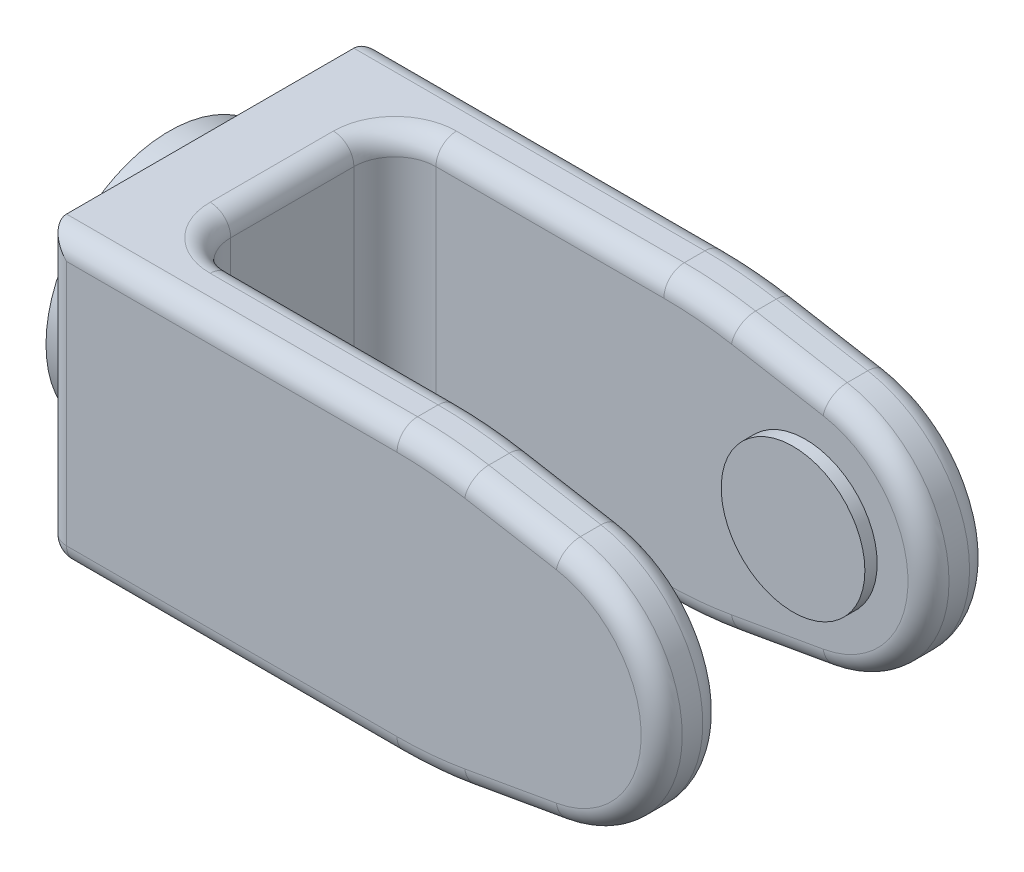
from build123d import *

# Parameters (mm, degrees)
BOSS_EXTRUDE1_DEPTH = 40
SKETCH2_W           = 180
SKETCH2_H           = 50
CUT_EXTRUDE1_DEPTH  = 171.293863659
SKETCH3_R           = 17.5
BOSS_EXTRUDE3_DEPTH = 3
SKETCH4_R           = 30
BOSS_EXTRUDE4_DEPTH = 10
SKETCH5_R           = 25
BOSS_EXTRUDE5_DEPTH = 3
FILLET2_R           = 100
FILLET3_R           = 10
FILLET4_R           = 5


with BuildPart() as part:
    # Sketch1 → Boss-Extrude1 (new, symmetric)
    with BuildSketch(Plane.XY):
        with BuildLine():
            Line((0, 0), (94.268250808, 0))
            Line((94.268250808, 0), (125.20944533, 5.45576741))
            ThreePointArc((125.20944533, 5.45576741), (150, 35), (125.20944533, 64.54423259))
            Line((125.20944533, 64.54423259), (94.268250808, 70))
            Line((94.268250808, 70), (0, 70))
            Line((0, 70), (0, 0))
        make_face()
    extrude(amount=BOSS_EXTRUDE1_DEPTH, both=True)

    # Sketch2 → Cut-Extrude1 (cut, through all)
    with BuildSketch(Plane(origin=(0, 0, 0), x_dir=(1, 0, 0), z_dir=(0, 1, 0))):
        with Locations((110, 0)):
            Rectangle(SKETCH2_W, SKETCH2_H)
    extrude(amount=CUT_EXTRUDE1_DEPTH, mode=Mode.SUBTRACT)

    # Sketch3 → Boss-Extrude3 (add)
    with BuildSketch(Plane.XY.offset(-25)):
        with Locations((120, 35)):
            Circle(SKETCH3_R)
    boss_extrude3 = extrude(amount=BOSS_EXTRUDE3_DEPTH)

    # Mirror1: Boss-Extrude3 across plane
    add(boss_extrude3.mirror(Plane.XY))

    # Sketch4 → Boss-Extrude4 (add)
    with BuildSketch(Plane.ZY):
        with Locations((0, 35)):
            Circle(SKETCH4_R)
    extrude(amount=BOSS_EXTRUDE4_DEPTH)

    # Sketch5 → Boss-Extrude5 (add)
    with BuildSketch(Plane.ZY.offset(10)):
        with Locations((0, 35)):
            Circle(SKETCH5_R)
    extrude(amount=BOSS_EXTRUDE5_DEPTH)

    # Fillet2
    fillet2_edges = [part.edges().sort_by_distance(p)[0] for p in [
        (94.268250808, 70, 32.5),
        (94.268250808, 0, 32.5),
        (94.268250808, 70, -32.5),
        (94.268250808, 0, -32.5),
    ]]
    fillet(fillet2_edges, radius=FILLET2_R)

    # Fillet3
    fillet3_edges = [part.edges().sort_by_distance(p)[0] for p in [
        (20, 35, 25),
        (20, 35, -25),
    ]]
    fillet(fillet3_edges, radius=FILLET3_R)

    # Fillet4
    fillet4_edges = [part.edges().sort_by_distance(p)[0] for p in [
        (0, 0, 0),
        (150, 35, 40),
        (114.046823776, 66.512503946, 40),
        (150, 35, 25),
        (114.046823776, 3.487496054, 25),
        (150, 35, -25),
        (114.046823776, 66.512503946, -25),
        (0, 35, 40),
        (57.759692228, 70, -25),
        (42.759692228, 70, -40),
        (42.759692228, 70, 40),
        (114.046823776, 3.487496054, -40),
        (94.23495873, 0.380530191, -40),
        (94.23495873, 69.619469809, -40),
        (114.046823776, 3.487496054, -25),
        (57.759692228, 0, -25),
        (94.23495873, 0.380530191, -25),
        (94.23495873, 69.619469809, -25),
        (114.046823776, 66.512503946, 25),
        (94.23495873, 0.380530191, 25),
        (94.23495873, 69.619469809, 25),
        (114.046823776, 3.487496054, 40),
        (94.23495873, 0.380530191, 40),
        (94.23495873, 69.619469809, 40),
        (114.046823776, 66.512503946, -40),
        (150, 35, -40),
        (42.759692228, 0, -40),
        (20, 0, 0),
        (20, 70, 0),
        (0, 35, -40),
        (57.759692228, 70, 25),
        (57.759692228, 0, 25),
        (42.759692228, 0, 40),
        (22.928932188, 0, 22.071067812),
        (22.928932188, 70, 22.071067812),
        (22.928932188, 0, -22.071067812),
        (22.928932188, 70, -22.071067812),
    ]]
    fillet(fillet4_edges, radius=FILLET4_R - 0.0001)  # a hair under: the kernel refuses the full size


solid = part.part
